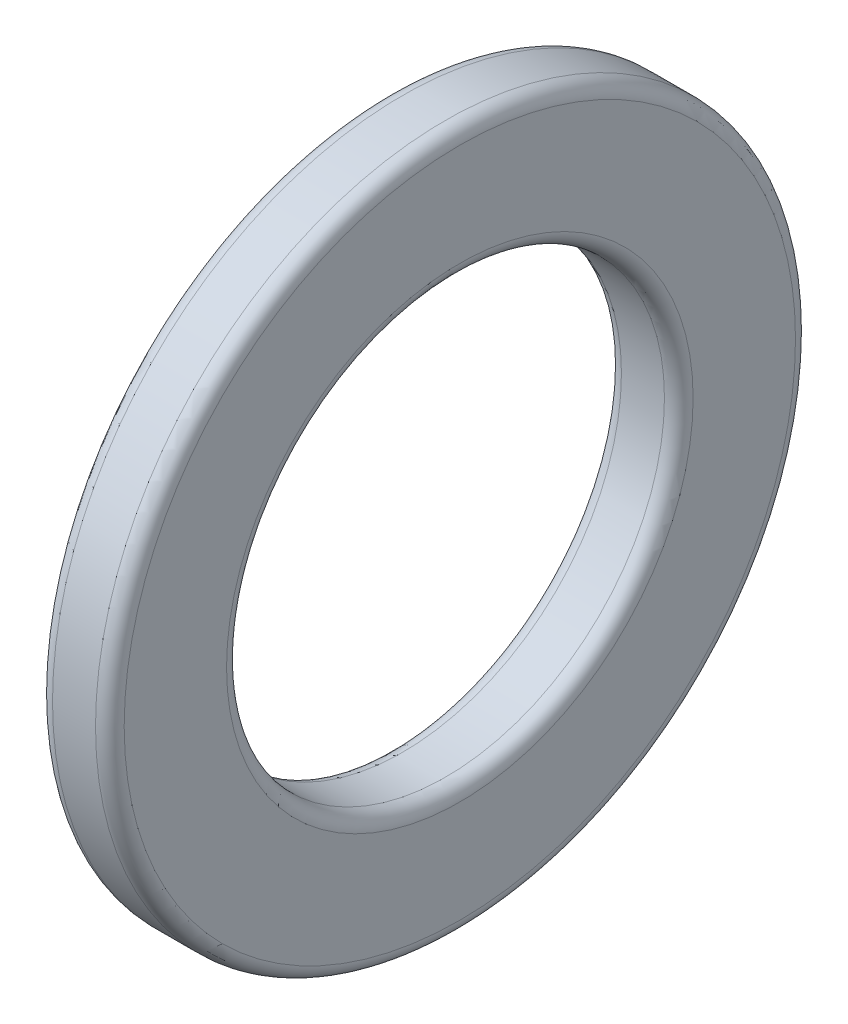
from build123d import *

# Parameters (mm, degrees)
SKETCH1_R           = 7.9375
SKETCH1_R_2         = 4.9657
BOSS_EXTRUDE1_DEPTH = 0.8128
FILLET1_R           = 0.32512


with BuildPart() as part:
    # Sketch1 → Boss-Extrude1 (new, symmetric)
    with BuildSketch(Plane(origin=(0, 0, 0), x_dir=(0, 0, -1), z_dir=(1, 0, 0))):
        Circle(SKETCH1_R)
        Circle(SKETCH1_R_2, mode=Mode.SUBTRACT)
    extrude(amount=BOSS_EXTRUDE1_DEPTH, both=True)

    # Fillet1
    fillet1_edges = [part.edges().sort_by_distance(p)[0] for p in [
        (0.8128, 0, 7.9375),
        (-0.8128, 0, 7.9375),
        (0.8128, 0, 4.9657),
        (-0.8128, 0, 4.9657),
    ]]
    fillet(fillet1_edges, radius=FILLET1_R)


solid = part.part
